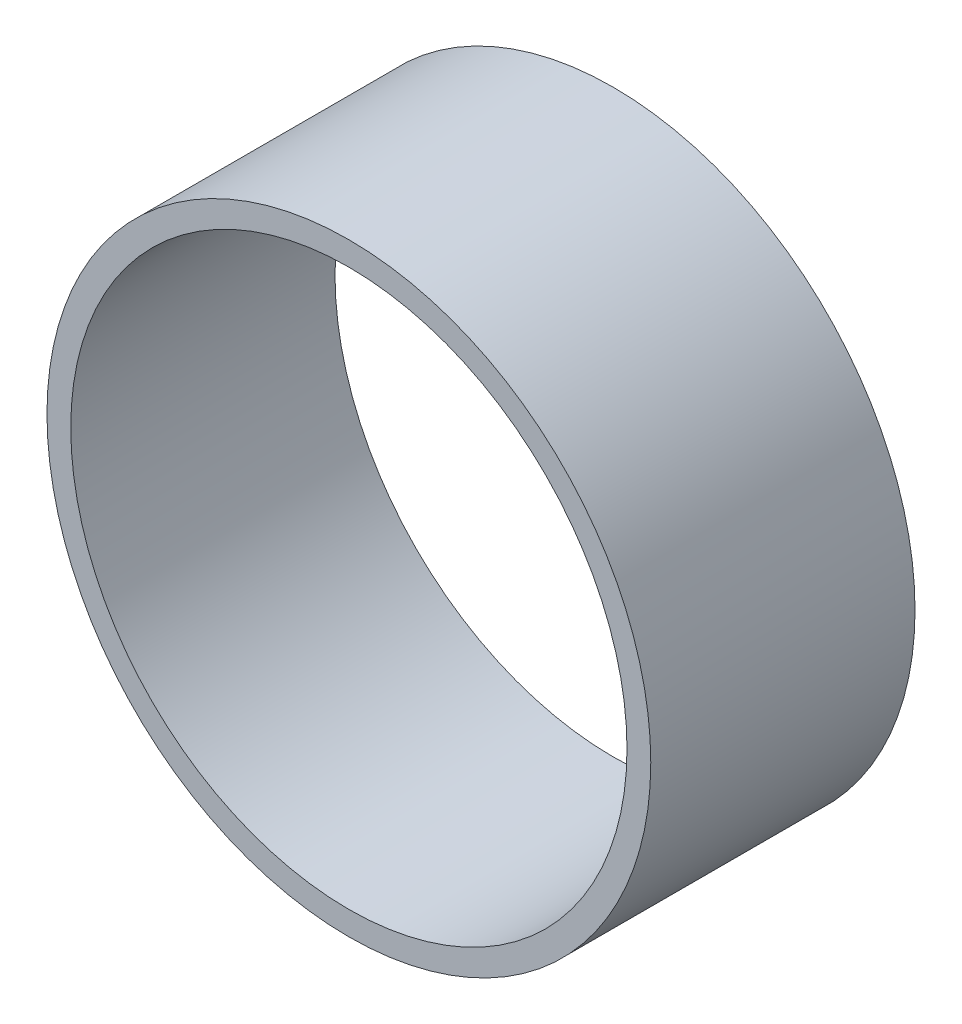
from build123d import *

# Parameters (mm, degrees)
SKETCH1_R           = 23
SKETCH1_R_2         = 21
BOSS_EXTRUDE1_DEPTH = 20
MOVE_FACE1_BY       = 0.15
MOVE_FACE2_BY       = 0.05


with BuildPart() as part:
    # Sketch1 → Boss-Extrude1 (new body)
    with BuildSketch(Plane.XY):
        Circle(SKETCH1_R)
        Circle(SKETCH1_R_2, mode=Mode.SUBTRACT)
    extrude(amount=BOSS_EXTRUDE1_DEPTH)

    # Move Face1: a curved face moved inward by 0.15
    add(Solid.thicken(part.faces().sort_by_distance((-23, 0, 10))[0], -MOVE_FACE1_BY), mode=Mode.SUBTRACT)

    # Move Face2: a curved face moved inward by 0.05
    add(Solid.thicken(part.faces().sort_by_distance((-21, 0, 10))[0], -MOVE_FACE2_BY), mode=Mode.SUBTRACT)


solid = part.part
